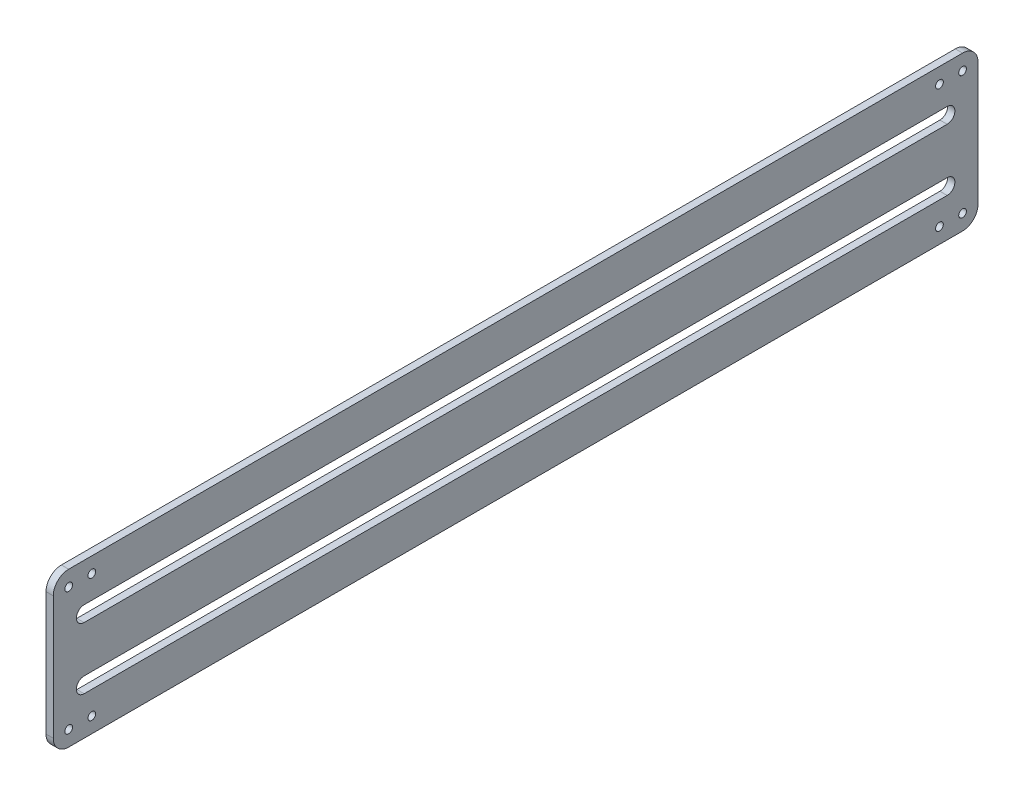
from build123d import *

# Parameters (mm, degrees)
OUTER_CUT_DEPTH   = 1.4986
SLOTS_DEPTH       = 194.150966106
SKETCH3_R         = 1.5875
MOUNT_HOLES_DEPTH = 194.150966106


with BuildPart() as part:
    # Sketch1 → Outer Cut (new, symmetric)
    with BuildSketch(Plane(origin=(0, 0, 0), x_dir=(0, 0, -1), z_dir=(1, 0, 0))):
        with BuildLine():
            Line((-184.15, -31.75), (184.15, -31.75))
            ThreePointArc((184.15, -31.75), (188.640128061, -29.890128061), (190.5, -25.4))
            Line((190.5, -25.4), (190.5, 25.4))
            ThreePointArc((190.5, 25.4), (188.640128061, 29.890128061), (184.15, 31.75))
            Line((184.15, 31.75), (-184.15, 31.75))
            ThreePointArc((-184.15, 31.75), (-188.640128061, 29.890128061), (-190.5, 25.4))
            Line((-190.5, 25.4), (-190.5, -25.4))
            ThreePointArc((-190.5, -25.4), (-188.640128061, -29.890128061), (-184.15, -31.75))
        make_face()
    extrude(amount=OUTER_CUT_DEPTH, both=True)

    # Sketch2 → Slots (cut, through all)
    with BuildSketch(Plane(origin=(1.4986, 0, 0), x_dir=(0, 0, -1), z_dir=(1, 0, 0))):
        with BuildLine():
            Line((-177.8, 15.875), (177.8, 15.875))
            ThreePointArc((177.8, 15.875), (180.975, 12.7), (177.8, 9.525))
            Line((177.8, 9.525), (-177.8, 9.525))
            ThreePointArc((-177.8, 9.525), (-180.975, 12.7), (-177.8, 15.875))
        make_face()
        with BuildLine():
            Line((-177.8, -15.875), (177.8, -15.875))
            ThreePointArc((177.8, -15.875), (180.975, -12.7), (177.8, -9.525))
            Line((177.8, -9.525), (-177.8, -9.525))
            ThreePointArc((-177.8, -9.525), (-180.975, -12.7), (-177.8, -15.875))
        make_face()
    extrude(amount=-SLOTS_DEPTH, mode=Mode.SUBTRACT)

    # Sketch3 → Mount Holes (cut, through all)
    with BuildSketch(Plane(origin=(1.4986, 0, 0), x_dir=(0, 0, -1), z_dir=(1, 0, 0))):
        with Locations((-184.15, 25.4)):
            Circle(SKETCH3_R)
        with Locations((-174.625, 25.4)):
            Circle(SKETCH3_R)
        with Locations((-174.625, -25.4)):
            Circle(SKETCH3_R)
        with Locations((-184.15, -25.4)):
            Circle(SKETCH3_R)
        with Locations((174.625, 25.4)):
            Circle(SKETCH3_R)
        with Locations((184.15, 25.4)):
            Circle(SKETCH3_R)
        with Locations((184.15, -25.4)):
            Circle(SKETCH3_R)
        with Locations((174.625, -25.4)):
            Circle(SKETCH3_R)
    extrude(amount=-MOUNT_HOLES_DEPTH, mode=Mode.SUBTRACT)


solid = part.part
